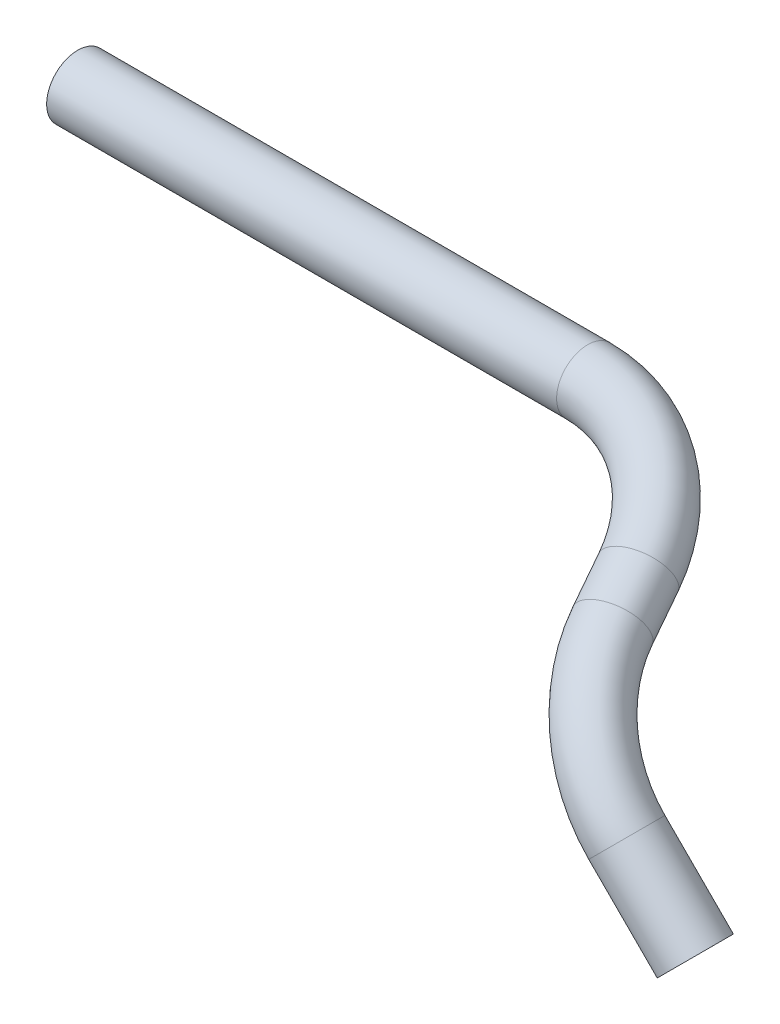
from build123d import *

# Parameters (mm, degrees)
SWEEP1_PROFILE_R = 12.7


with BuildPart() as part:
    # Sweep1: sweep along a curve in space
    with BuildLine() as sweep1_path:
        Line((0, 0, 0), (-27.957770282, 27.957770282, 0))
        ThreePointArc((-27.957770282, 27.957770282, 0), (-50.03467014, 50.782151029, -8.490952087), (-65.448601622, 68.238238275, -31.688664593))
        Line((-65.448601622, 68.238238275, -31.688664593), (-71.485347108, 75.730869643, -48.226689119))
        ThreePointArc((-71.485347108, 75.730869643, -48.226689119), (-94.593311277, 88.715779611, -76.887482501), (-131.741956946, 93.667995145, -87.818203358))
        Line((-131.741956946, 93.667995145, -87.818203358), (-339.937127276, 93.667995145, -87.818203358))
    # Sweep1 profile (on start of the path) → Sweep1 (sweep)
    with BuildSketch(Plane(origin=(0, 0, 0), x_dir=(0.7071067811865488, 0.7071067811865464, 0), z_dir=(-0.7071067811865464, 0.7071067811865488, 0))):
        Circle(SWEEP1_PROFILE_R)
    sweep(path=sweep1_path.line)


solid = part.part
